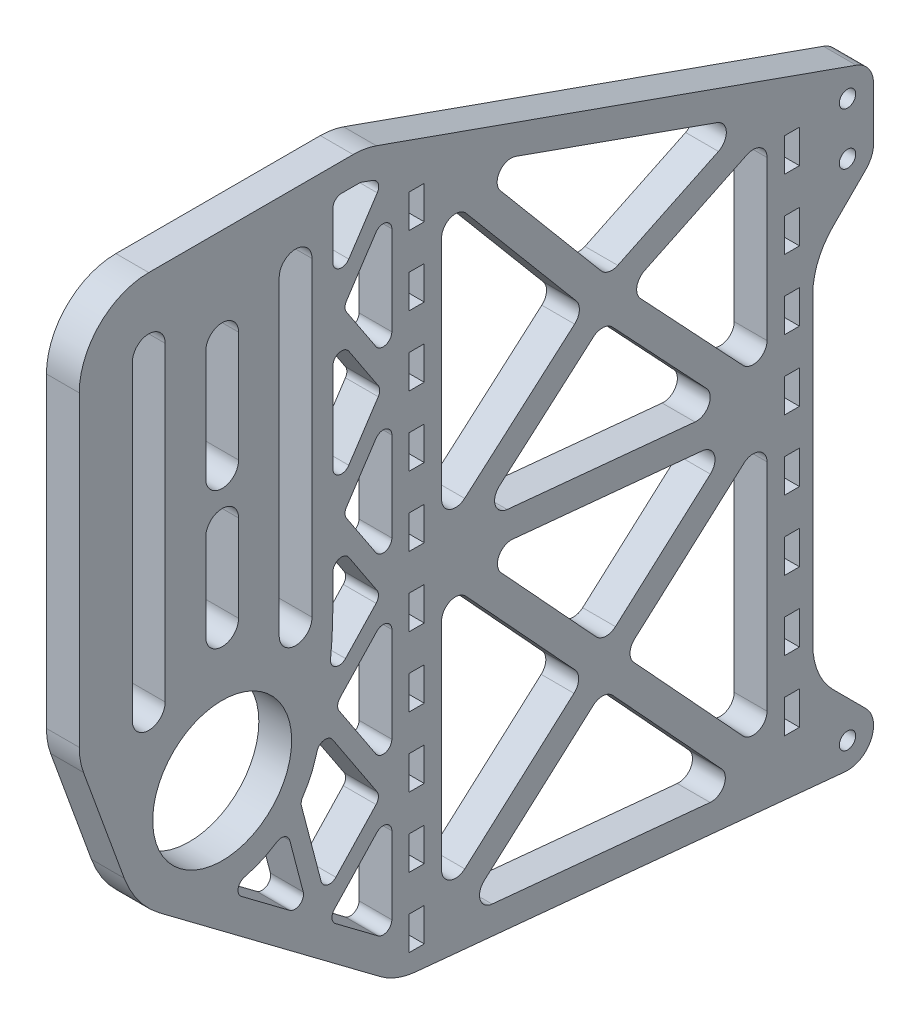
from build123d import *

# Parameters (mm, degrees)
SKETCH4_R               = 1.5
SKETCH4_R_2             = 12.7
BOSS_EXTRUDE1_DEPTH     = 3
SKETCH5_W               = 2.75
SKETCH5_H               = 6.096
LOWERSLOT_DEPTH         = 120.792356667
SKETCH5_3_W             = 2.75
SKETCH5_3_H             = 6.096
UPPERSLOT_DEPTH         = 120.792356667
LOWERSLOTS_COUNT        = 8
LOWERSLOTS_PITCH        = 12.7
LPATTERN2_COUNT         = 10
LPATTERN2_PITCH         = 12.7
CUT_EXTRUDE1_DEPTH      = 120.792356667
CUT_EXTRUDE1_DEPTH_BACK = 120.792356667
CUT_EXTRUDE2_DEPTH      = 120.792356667
CUT_EXTRUDE2_DEPTH_BACK = 120.792356667
FILLET1_R               = 2.54
FILLET2_R               = 1.5875
FILLET3_R               = 12.7


with BuildPart() as part:
    # Sketch4 → Boss-Extrude1 (new, symmetric)
    with BuildSketch(Plane(origin=(0, 0, 0), x_dir=(0, 0, -1), z_dir=(1, 0, 0))):
        with BuildLine():
            ThreePointArc((47.817596045, 22.032403955), (48.849976274, 23.577470153), (49.2125, 25.4))
            Line((49.2125, 25.4), (49.2125, 34.925))
            ThreePointArc((49.2125, 34.925), (48.339904561, 37.672735205), (46.041875851, 39.413578564))
            Line((46.041875851, 39.413578564), (-43.726606241, 71.25))
            Line((-43.726606241, 71.25), (-95.973393759, 71.25))
            Line((-95.973393759, 71.25), (-95.973393759, 0.199960648))
            Line((-95.973393759, 0.199960648), (-87.751144426, -22.39048373))
            ThreePointArc((-87.751144426, -22.39048373), (-85.15059817, -27.223753043), (-81.28, -31.115))
            Line((-81.28, -31.115), (-38.1, -63.5))
            Line((-38.1, -63.5), (43.992912904, -71.415514491))
            ThreePointArc((43.992912904, -71.415514491), (48.757334408, -68.706816071), (47.817596045, -63.307403955))
            Line((47.817596045, -63.307403955), (38.1, -53.589807909))
            Line((38.1, -53.589807909), (38.1, 12.314807909))
            Line((38.1, 12.314807909), (47.817596045, 22.032403955))
        make_face()
        with Locations((44.45, -66.675)):
            Circle(SKETCH4_R, mode=Mode.SUBTRACT)
        with BuildLine():
            ThreePointArc((-80.273393759, 1.775), (-83.273393759, -1.225), (-86.273393759, 1.775))
            Line((-86.273393759, 1.775), (-86.273393759, 58.55))
            ThreePointArc((-86.273393759, 58.55), (-83.273393759, 61.55), (-80.273393759, 58.55))
            Line((-80.273393759, 58.55), (-80.273393759, 1.775))
        make_face(mode=Mode.SUBTRACT)
        with BuildLine():
            ThreePointArc((-66.85, 8.3125), (-69.85, 5.3125), (-72.85, 8.3125))
            Line((-72.85, 8.3125), (-72.85, 24.1875))
            ThreePointArc((-72.85, 24.1875), (-69.85, 27.1875), (-66.85, 24.1875))
            Line((-66.85, 24.1875), (-66.85, 8.3125))
        make_face(mode=Mode.SUBTRACT)
        with BuildLine():
            Line((-66.85, 53.6), (-66.85, 33.3625))
            ThreePointArc((-66.85, 33.3625), (-69.85, 30.3625), (-72.85, 33.3625))
            Line((-72.85, 33.3625), (-72.85, 53.6))
            ThreePointArc((-72.85, 53.6), (-69.85, 56.6), (-66.85, 53.6))
        make_face(mode=Mode.SUBTRACT)
        with BuildLine():
            ThreePointArc((-53.426606241, 1.775), (-56.426606241, -1.225), (-59.426606241, 1.775))
            Line((-59.426606241, 1.775), (-59.426606241, 58.55))
            ThreePointArc((-59.426606241, 58.55), (-56.426606241, 61.55), (-53.426606241, 58.55))
            Line((-53.426606241, 58.55), (-53.426606241, 1.775))
        make_face(mode=Mode.SUBTRACT)
        with Locations((44.45, 25.4)):
            Circle(SKETCH4_R, mode=Mode.SUBTRACT)
        with Locations((44.45, 34.925)):
            Circle(SKETCH4_R, mode=Mode.SUBTRACT)
        with Locations((-69.85, -15.875)):
            Circle(SKETCH4_R_2, mode=Mode.SUBTRACT)
    extrude(amount=BOSS_EXTRUDE1_DEPTH, both=True)

    # Sketch5 → LowerSlot (cut, symmetric)
    with BuildSketch(Plane(origin=(3, 0, 0), x_dir=(0, 0, -1), z_dir=(1, 0, 0))):
        with Locations((34.29, -57.15)):
            Rectangle(SKETCH5_W, SKETCH5_H)
    lowerslot = extrude(amount=LOWERSLOT_DEPTH, both=True, mode=Mode.SUBTRACT)

    # Sketch5<3> → UpperSlot (cut, symmetric)
    with BuildSketch(Plane(origin=(3, 0, 0), x_dir=(0, 0, -1), z_dir=(1, 0, 0))):
        with Locations((-34.29, -57.15)):
            Rectangle(SKETCH5_3_W, SKETCH5_3_H)
    upperslot = extrude(amount=UPPERSLOT_DEPTH, both=True, mode=Mode.SUBTRACT)

    # LowerSlots: LowerSlot ×8
    with Locations(*[(0, i * LOWERSLOTS_PITCH, 0) for i in range(1, LOWERSLOTS_COUNT)]):
        add(lowerslot, mode=Mode.SUBTRACT)

    # LPattern2: UpperSlot ×10
    with Locations(*[(0, i * LPATTERN2_PITCH, 0) for i in range(1, LPATTERN2_COUNT)]):
        add(upperslot, mode=Mode.SUBTRACT)

    # Sketch6 → Cut-Extrude1 (cut, two sides: drawn at the far end of the back side and taken through both)
    with BuildSketch(Plane(origin=(3, 0, 0), x_dir=(0, 0, -1), z_dir=(1, 0, 0)).offset(-CUT_EXTRUDE1_DEPTH_BACK)):
        Polygon((-29.74, -4.159515549), (-29.74, -55.798883328), (-3.617530932, -32.497964764), align=None)
        Polygon((-0.173977051, -36.233636783), (-26.296446119, -59.534555348), (25.948492017, -64.572085997), align=None)
        Polygon((-23.36678753, -3.578249007), (0.173977051, -29.115986647), (23.714741632, -8.117916479), align=None)
        Polygon((29.74, -9.550740101), (3.617530932, -32.851658666), (29.74, -61.190107881), align=None)
        Polygon((-29.74, 56.952974066), (-29.74, 2.958675399), (-3.549347816, 25.805895933), align=None)
        Polygon((-0.175685561, 22.007624532), (-23.626632395, 1.550365573), (23.275261273, -2.971981191), align=None)
        Polygon((4.225161053, 24.741958988), (29.74, -2.436074441), (29.74, 36.987638329), align=None)
        Polygon((26.36423534, 41.002246475), (-25.011163091, 59.222548276), (0.676536125, 28.673603984), align=None)
    extrude(amount=CUT_EXTRUDE1_DEPTH + CUT_EXTRUDE1_DEPTH_BACK, mode=Mode.SUBTRACT)

    # Sketch6<3> → Cut-Extrude2 (cut, two sides: drawn at the far end of the back side and taken through both)
    with BuildSketch(Plane(origin=(3, 0, 0), x_dir=(0, 0, -1), z_dir=(1, 0, 0)).offset(-CUT_EXTRUDE2_DEPTH_BACK)):
        Polygon((-50.566109593, -47.800417805), (-38.84, -56.595), (-38.84, -35.323421976), align=None)
        Polygon((-49.180428609, -14.466821123), (-38.84, -30.124629024), (-38.84, -3.464238929), align=None)
        with BuildLine():
            Line((-69.433181898, -33.650113577), (-53.885950089, -45.310537433))
            Line((-53.885950089, -45.310537433), (-58.099239453, -29.218463815))
            ThreePointArc((-58.099239453, -29.218463815), (-63.375251167, -32.434167478), (-69.433181898, -33.650113577))
        make_face()
        Polygon((-47.71416834, 15.172103704), (-38.84, 1.734554024), (-38.84, 28.609653385), align=None)
        with BuildLine():
            ThreePointArc((-52.744055381, -20.724232793), (-53.887483076, -23.70612083), (-55.545901002, -26.435357563))
            Line((-55.545901002, -26.435357563), (-51.035185303, -43.663409762))
            Line((-51.035185303, -43.663409762), (-40.856390127, -32.832811265))
            Line((-40.856390127, -32.832811265), (-51.660229876, -16.473291387))
            ThreePointArc((-51.660229876, -16.473291387), (-52.173880395, -18.605967866), (-52.744055381, -20.724232793))
        make_face()
        Polygon((-47.71416834, 47.808667764), (-38.84, 34.371118083), (-38.84, 61.246217444), align=None)
        with BuildLine():
            ThreePointArc((-49.616606241, 1.775), (-49.882802907, -4.846843128), (-50.679674961, -11.425951122))
            Line((-50.679674961, -11.425951122), (-40.856390127, -0.973628217))
            Line((-40.856390127, -0.973628217), (-49.616606241, 12.291371355))
            Line((-49.616606241, 12.291371355), (-49.616606241, 1.775))
        make_face()
        Polygon((-44.600745323, 66.17), (-49.616606241, 66.17), (-49.616606241, 50.689400113), (-40.381419868, 64.673614852), align=None)
        Polygon((-49.616606241, 44.927935415), (-49.616606241, 18.052836053), (-40.742437901, 31.490385734), align=None)
    extrude(amount=CUT_EXTRUDE2_DEPTH + CUT_EXTRUDE2_DEPTH_BACK, mode=Mode.SUBTRACT)

    # Fillet1
    fillet1_edges = [part.edges().sort_by_distance(p)[0] for p in [
        (0, 25.805895933, 3.549347816),
        (0, 56.952974066, 29.74),
        (0, 2.958675399, 29.74),
        (0, 28.673603984, -0.676536125),
        (0, 41.002246475, -26.36423534),
        (0, 59.222548276, 25.011163091),
        (0, 24.741958988, -4.225161053),
        (0, -2.436074441, -29.74),
        (0, 36.987638329, -29.74),
        (0, -2.971981191, -23.275261273),
        (0, 22.007624532, 0.175685561),
        (0, 1.550365573, 23.626632395),
        (0, -29.115986647, -0.173977051),
        (0, -8.117916479, -23.714741632),
        (0, -32.851658666, -3.617530932),
        (0, -61.190107881, -29.74),
        (0, -9.550740101, -29.74),
        (0, -36.233636783, 0.173977051),
        (0, -59.534555348, 26.296446119),
        (0, -64.572085997, -25.948492017),
        (0, -4.159515549, 29.74),
        (0, -55.798883328, 29.74),
        (0, -32.497964764, 3.617530932),
        (0, -3.578249007, 23.36678753),
    ]]
    fillet(fillet1_edges, radius=FILLET1_R)

    # Fillet2
    fillet2_edges = [part.edges().sort_by_distance(p)[0] for p in [
        (0, 64.673614852, 40.381419868),
        (0, 66.17, 44.600745323),
        (0, 66.17, 49.616606241),
        (0, 50.689400113, 49.616606241),
        (0, 47.808667764, 47.71416834),
        (0, 34.371118083, 38.84),
        (0, 61.246217444, 38.84),
        (0, 31.490385734, 40.742437901),
        (0, 44.927935415, 49.616606241),
        (0, 18.052836053, 49.616606241),
        (0, 15.172103704, 47.71416834),
        (0, 1.734554024, 38.84),
        (0, 28.609653385, 38.84),
        (0, -11.425951122, 50.679674961),
        (0, -0.973628217, 40.856390127),
        (0, 12.291371355, 49.616606241),
        (0, -30.124629024, 38.84),
        (0, -3.464238929, 38.84),
        (0, -26.435357563, 55.545901002),
        (0, -43.663409762, 51.035185303),
        (0, -32.832811265, 40.856390127),
        (0, -16.473291387, 51.660229876),
        (0, -35.323421976, 38.84),
        (0, -47.800417805, 50.566109593),
        (0, -56.595, 38.84),
        (0, -33.650113577, 69.433181898),
        (0, -45.310537433, 53.885950089),
        (0, -29.218463815, 58.099239453),
        (0, -14.466821123, 49.180428609),
    ]]
    fillet(fillet2_edges, radius=FILLET2_R)

    # Fillet3
    fillet3_edges = [part.edges().sort_by_distance(p)[0] for p in [
        (0, -63.5, 38.1),
        (0, 71.25, 43.726606241),
        (0, 71.25, 95.973393759),
        (0, 0.199960648, 95.973393759),
        (0, 12.314807909, -38.1),
        (0, -53.589807909, -38.1),
    ]]
    fillet(fillet3_edges, radius=FILLET3_R)


solid = part.part
